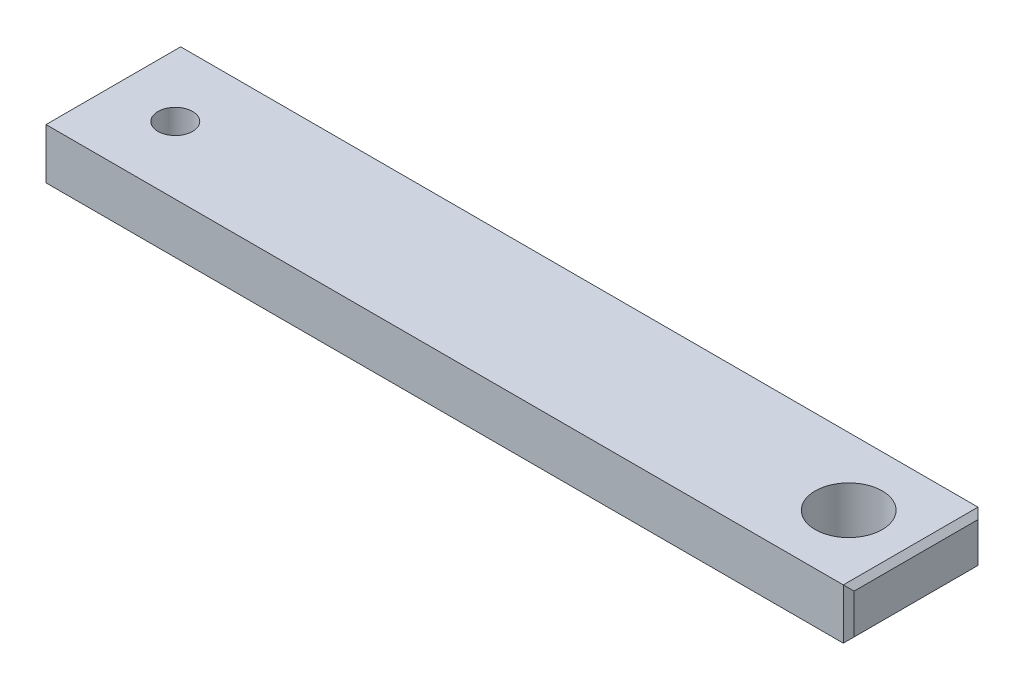
from build123d import *

# Parameters (mm, degrees)
SKETCH1_W             = 76.2
SKETCH1_H             = 12.7
BOSS_EXTRUDE2_DEPTH   = 4.7625
F_4_CLEARANCE_HOLE1_D = 3.2639
SKETCH2_R             = 3.1623
CUT_EXTRUDE1_DEPTH    = 71.299547696
CHAMFER1_SIZE         = 0.508


with BuildPart() as part:
    # Sketch1 → Boss-Extrude2 (new body)
    with BuildSketch(Plane(origin=(0, 0, 0), x_dir=(1, 0, 0), z_dir=(0, 1, 0))):
        with BuildLine():
            Line((-63.5, 6.35), (0, 6.35))
            ThreePointArc((0, 6.35), (6.35, 0), (0, -6.35))
            Line((0, -6.35), (-63.5, -6.35))
            ThreePointArc((-63.5, -6.35), (-69.85, 0), (-63.5, 6.35))
        make_face()
        with Locations((-31.75, 0)):
            Rectangle(SKETCH1_W, SKETCH1_H)
    extrude(amount=BOSS_EXTRUDE2_DEPTH)

    # #4 Clearance Hole1 (through all)
    with Locations(Plane(origin=(0, 4.7625, 0), x_dir=(1, 0, 0), z_dir=(0, 1, 0))):
        with Locations((-63.5, 0)):
            Hole(F_4_CLEARANCE_HOLE1_D / 2)

    # Sketch2 → Cut-Extrude1 (cut, through all)
    with BuildSketch(Plane(origin=(0, 4.7625, 0), x_dir=(1, 0, 0), z_dir=(0, 1, 0))):
        Circle(SKETCH2_R)
    extrude(amount=-CUT_EXTRUDE1_DEPTH, mode=Mode.SUBTRACT)

    # Chamfer1
    chamfer1_edges = [part.edges().sort_by_distance(p)[0] for p in [
        (-69.85, 2.38125, -6.35),
        (-69.85, 4.7625, 0),
        (-69.85, 2.38125, 6.35),
        (-69.85, 0, 0),
        (6.35, 2.38125, 6.35),
        (6.35, 4.7625, 0),
        (6.35, 2.38125, -6.35),
        (6.35, 0, 0),
    ]]
    chamfer(chamfer1_edges, length=CHAMFER1_SIZE)


solid = part.part
